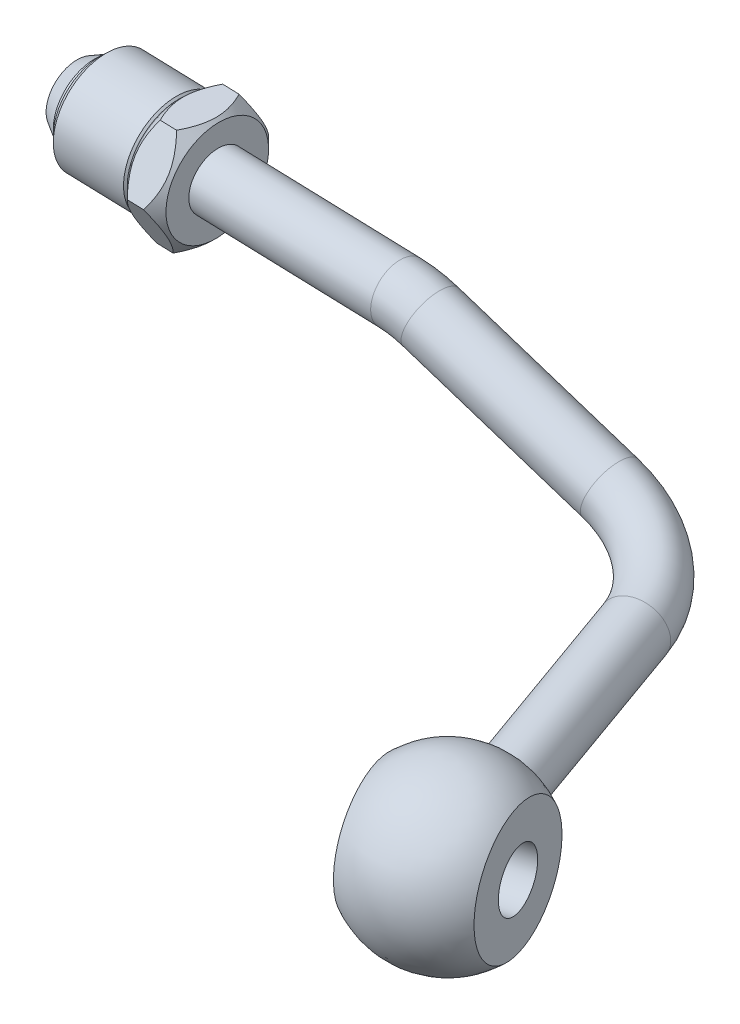
from build123d import *

# Parameters (mm, degrees)
IZIM6_R                     = 5
IZIM7_R                     = 7
Y_KSEKLIK_EKSTR_ZYON4_DEPTH = 4
IZIM8_R                     = 9
Y_KSEKLIK_EKSTR_ZYON5_DEPTH = 14
Y_KSEKLIK_EKSTR_ZYON6_DEPTH = 6.8
PAH3_SIZE                   = 1
PAH4_SIZE                   = 3
PAH4_SIZE2                  = 1.732050808
KES_EKSTR_ZYON2_DEPTH       = 40
IZIM16_R                    = 5
KES_EKSTR_ZYON3_DEPTH       = 20
IZIM17_R                    = 4


# Read off the part's stored shape, not the designer's step: Kes-Döndür5
with BuildPart() as part:
    # Süpür2: sweep along a curve in space
    with BuildLine() as s_p_r2_path:
        Line((0, 0, 0), (56.718021516, -1.806734242, 0))
        ThreePointArc((62.272824235, -2.779118041, 0), (59.529866977, -2.096162077, 0), (56.718021516, -1.806734242, 0))
        Line((62.272824235, -2.779118041, 0), (93.753257718, -13.028291116, 0))
        ThreePointArc((112.028316303, -18.42927259, 13.897253926), (105.011429248, -16.541825325, 3.843978082), (93.753257718, -13.028291116, 0))
        Line((112.028316303, -18.42927259, 13.897253926), (127.219469031, -21.476290386, 61.973686406))
    # Çizim6 → Süpür2 (sweep)
    with BuildSketch(Plane(origin=(0, 0, 0), x_dir=(0, 0, -1), z_dir=(0.9994930255797312, -0.03183852725040804, 0))):
        Circle(IZIM6_R)
    sweep(path=s_p_r2_path.line)

    # Çizim7 → Yükseklik-Ekstrüzyon4 (add)
    with BuildSketch(Plane(origin=(0, 0, 0), x_dir=(0, 0, 1), z_dir=(-0.9994930255797312, 0.03183852725040805, 0))):
        with Locations(Location((0, 0, 0), (0, 0, 270))):
            Circle(IZIM7_R)
    extrude(amount=-Y_KSEKLIK_EKSTR_ZYON4_DEPTH)

    # Çizim8 → Yükseklik-Ekstrüzyon5 (add)
    with BuildSketch(Plane(origin=(3.997972102, -0.127354109, 0), x_dir=(0, 0, -1), z_dir=(0.9994930255797312, -0.031838527250408054, 0))):
        with Locations(Location((0, 0, 0), (0, 0, 90))):
            Circle(IZIM8_R)
    extrude(amount=Y_KSEKLIK_EKSTR_ZYON5_DEPTH)

    # Çizim9 → Yükseklik-Ekstrüzyon6 (add)
    with BuildSketch(Plane(origin=(17.99087446, -0.573093491, 0), x_dir=(0, 0, -1), z_dir=(0.9994930255797312, -0.03183852725040806, 0))):
        Polygon((10.969655115, 0), (5.484827557, 9.5), (-5.484827557, 9.5), (-10.969655115, 0), (-5.484827557, -9.5), (5.484827557, -9.5), align=None)
    extrude(amount=Y_KSEKLIK_EKSTR_ZYON6_DEPTH)

    # Pah3
    pah3_edges = [part.edges().sort_by_distance(p)[0] for p in [
        (3.711425357, -9.122791339, 0),
    ]]
    chamfer(pah3_edges, length=PAH3_SIZE)

    # Pah4
    pah4_edges = [part.edges().sort_by_distance(p)[0] for p in [
        (0.222869691, 6.996451179, 0),
    ]]
    pah4_side = [part.faces().sort_by_distance(p)[0] for p in [
        (2.221855742, 6.932774125, 0),
    ]]
    chamfer(pah4_edges, length=PAH4_SIZE, length2=PAH4_SIZE2, reference=pah4_side[0])

    # Çizim10 → Kes-Döndür2 (revolve, cut)
    with BuildSketch(Plane.XY):
        Polygon((22.618780487, 10.827793669), (25.852660243, 7.381106616), (28.637042918, 10.827793669), align=None)
        Polygon((20.847453028, 10.838567795), (17.932722309, 8.103800024), (15.366806113, 10.838567795), align=None)
    revolve(axis=Axis((17.99087446, -0.573093491, 0), (0.9994930255797312, -0.03183852725040806, 0)), mode=Mode.SUBTRACT)

    # Çizim14 → Döndür2 (revolve)
    with BuildSketch(Plane(origin=(29.636413051, -5.944425654, 93.792290583), x_dir=(0.9537039040924367, 0.019022772482439516, -0.30014496072052566), z_dir=(0.30074717508040627, -0.06032340080439443, 0.9517942130505669))):
        with BuildLine():
            Line((102.320076034, -2.513344877), (102.320076034, -32.513344877))
            ThreePointArc((102.320076034, -32.513344877), (117.320076034, -17.513344877), (102.320076034, -2.513344877))
        make_face()
    revolve(axis=Axis((127.219469031, -6.506326297, 62.922462025), (0, -0.9979976059302316, -0.06325170794157503)))

    # Çizim15 → Kes-Ekstrüzyon2 (cut)
    with BuildSketch(Plane(origin=(0, 0, 0), x_dir=(1, 0, 0), z_dir=(0, 1, 0))):
        Polygon((132.389771245, -43.488442314), (142.340651861, -78.720795845), (151.231048207, -76.209828969), (141.280167591, -40.977475439), align=None)
        Polygon((113.00322211, -48.430617202), (123.048070303, -83.99567484), (112.182017345, -87.064638021), (102.137169152, -51.499580383), align=None)
    extrude(amount=-KES_EKSTR_ZYON2_DEPTH, mode=Mode.SUBTRACT)

    # Çizim16 → Kes-Ekstrüzyon3 (cut)
    with BuildSketch(Plane(origin=(91.986882531, 0, -25.980395705), x_dir=(0.2718029884745819, 0, 0.9623529162715133), z_dir=(-0.9623529162715133, 0, 0.2718029884745819))):
        with Locations((94.21918972, -21.476290386)):
            Circle(IZIM16_R)
    extrude(amount=-KES_EKSTR_ZYON3_DEPTH, mode=Mode.SUBTRACT)

    # Kes-Süpür2: sweep along a curve in space
    with BuildLine() as kes_s_p_r2_path:
        Line((0, 0, 0), (56.718021516, -1.806734242, 0))
        ThreePointArc((62.272824235, -2.779118041, 0), (59.529866977, -2.096162077, 0), (56.718021516, -1.806734242, 0))
        Line((62.272824235, -2.779118041, 0), (93.753257718, -13.028291116, 0))
        ThreePointArc((112.028316303, -18.42927259, 13.897253926), (105.011429248, -16.541825325, 3.843978082), (93.753257718, -13.028291116, 0))
        Line((112.028316303, -18.42927259, 13.897253926), (127.219469031, -21.476290386, 61.973686406))
    # Çizim17 → Kes-Süpür2 (sweep, cut)
    with BuildSketch(Plane(origin=(0, 0, 0), x_dir=(0, 0, 1), z_dir=(-0.9994930255797312, 0.03183852725040805, 0))):
        Circle(IZIM17_R)
    sweep(path=kes_s_p_r2_path.line, mode=Mode.SUBTRACT)

    # Kes-Döndür5 outline → Kes-Döndür5 (revolve, cut)
    with BuildSketch(Plane(origin=(25.609057337, -21.476290386, 90.672111995), x_dir=(0, 1, 0), z_dir=(-0.2718029884745821, 0, -0.9623529162715133))):
        with BuildLine():
            ThreePointArc((5, 101.687958803), (8.1, 105.585393857), (5, 109.482828911))
            Line((5, 109.482828911), (5, 101.687958803))
        make_face()
    revolve(axis=Axis((25.609057337, -21.476290386, 90.672111995), (0.9623529162715133, 0, -0.2718029884745821)), mode=Mode.SUBTRACT)


solid = part.part
